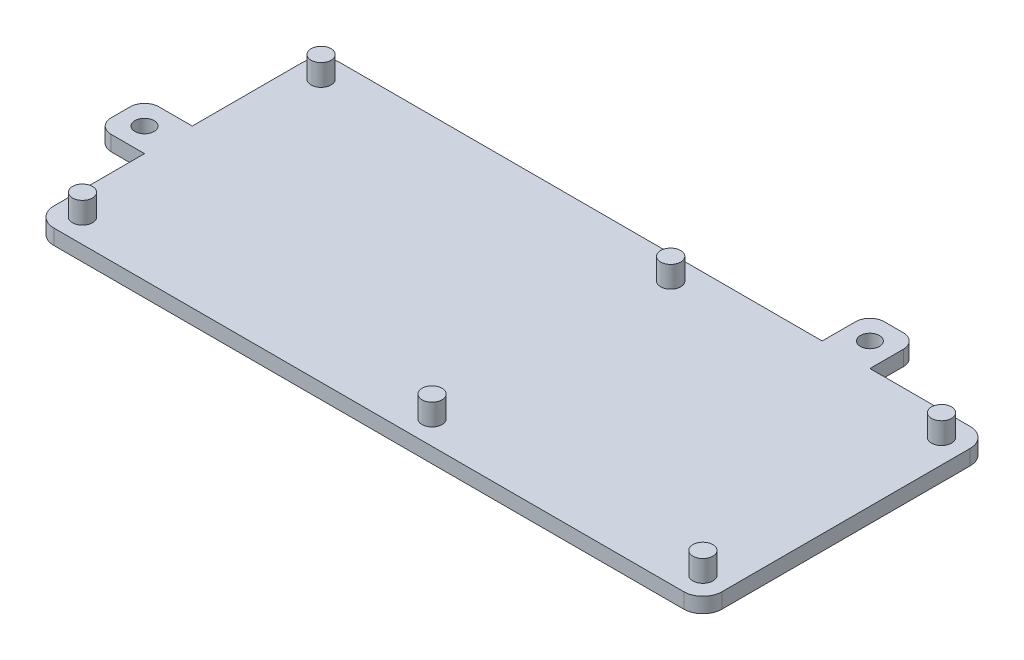
from build123d import *

# Parameters (mm, degrees)
SKETCH1_R             = 2.0955
BOSS_EXTRUDE1_DEPTH   = 4.5
BOSS_EXTRUDE1_2_DEPTH = 4.5
BOSS_EXTRUDE1_3_DEPTH = 4.5
BOSS_EXTRUDE1_4_DEPTH = 4.5
BOSS_EXTRUDE1_5_DEPTH = 4.5
BOSS_EXTRUDE1_6_DEPTH = 4.5
SKETCH2_W             = 140
SKETCH2_H             = 60
BOSS_EXTRUDE2_DEPTH   = 3.175
FILLET1_R             = 4
SKETCH3_W             = 10
SKETCH3_H             = 10
SKETCH3_R             = 2
BOSS_EXTRUDE3_DEPTH   = 3.175
FILLET3_R             = 3
FILLET4_R             = 3


with BuildPart() as part:
    # Sketch1 → Boss-Extrude1 (new body)
    with BuildSketch(Plane.XZ.offset(38.063324544)):
        with Locations((-181.839905385, -5.726884341)):
            Circle(SKETCH1_R)
    extrude(amount=BOSS_EXTRUDE1_DEPTH)



with BuildPart() as body_2:
    # Sketch1 → Boss-Extrude1 2 (new body)
    with BuildSketch(Plane.XZ.offset(38.063324544)):
        with Locations((-108.589905385, -5.726884341)):
            Circle(SKETCH1_R)
    extrude(amount=BOSS_EXTRUDE1_2_DEPTH)


with BuildPart() as body_3:
    # Sketch1 → Boss-Extrude1 3 (new body)
    with BuildSketch(Plane.XZ.offset(38.063324544)):
        with Locations((-51.839905385, -5.726884341)):
            Circle(SKETCH1_R)
    extrude(amount=BOSS_EXTRUDE1_3_DEPTH)


with BuildPart() as body_4:
    # Sketch1 → Boss-Extrude1 4 (new body)
    with BuildSketch(Plane.XZ.offset(38.063324544)):
        with Locations((-51.839905385, 44.273115659)):
            Circle(SKETCH1_R)
    extrude(amount=BOSS_EXTRUDE1_4_DEPTH)


with BuildPart() as body_5:
    # Sketch1 → Boss-Extrude1 5 (new body)
    with BuildSketch(Plane.XZ.offset(38.063324544)):
        with Locations((-108.589905385, 44.273115659)):
            Circle(SKETCH1_R)
    extrude(amount=BOSS_EXTRUDE1_5_DEPTH)


with BuildPart() as body_6:
    # Sketch1 → Boss-Extrude1 6 (new body)
    with BuildSketch(Plane.XZ.offset(38.063324544)):
        with Locations((-181.839905385, 44.273115659)):
            Circle(SKETCH1_R)
    extrude(amount=BOSS_EXTRUDE1_6_DEPTH)


with BuildPart() as part_1:
    add(part.part)

    add(body_2.part)  # Boss-Extrude2 merges body 2

    add(body_3.part)  # Boss-Extrude2 merges body 3

    add(body_4.part)  # Boss-Extrude2 merges body 4

    add(body_5.part)  # Boss-Extrude2 merges body 5

    add(body_6.part)  # Boss-Extrude2 merges body 6
    # Sketch2 → Boss-Extrude2 (add)
    with BuildSketch(Plane.XZ.offset(42.563324544)):
        with Locations((-116.839905385, 19.273115659)):
            Rectangle(SKETCH2_W, SKETCH2_H)
    extrude(amount=BOSS_EXTRUDE2_DEPTH)

    # Fillet1
    fillet1_edges = [part_1.edges().sort_by_distance(p)[0] for p in [
        (-46.839905385, -44.150824544, -10.726884341),
        (-46.839905385, -44.150824544, 49.273115659),
        (-186.839905385, -44.150824544, -10.726884341),
        (-186.839905385, -44.150824544, 49.273115659),
    ]]
    fillet(fillet1_edges, radius=FILLET1_R)

    # Sketch3 → Boss-Extrude3 (add)
    # profile 1 of 2: a face of its own
    with BuildSketch(Plane.XZ.offset(45.738324544)):
        with Locations((-191.839905385, 21.273115659)):
            Rectangle(SKETCH3_W, SKETCH3_H)
        with Locations((-191.839905385, 21.273115659)):
            Circle(SKETCH3_R, mode=Mode.SUBTRACT)
    # profile 2 of 2: a face of its own
    with BuildSketch(Plane.XZ.offset(45.738324544)):
        with Locations((-76.839905385, -15.726884341)):
            Rectangle(SKETCH3_W, SKETCH3_H)
        with Locations((-76.839905385, -15.726884341)):
            Circle(SKETCH3_R, mode=Mode.SUBTRACT)
    extrude(amount=-BOSS_EXTRUDE3_DEPTH)

    # Fillet3
    fillet3_edges = [part_1.edges().sort_by_distance(p)[0] for p in [
        (-81.839905385, -44.150824544, -20.726884341),
        (-71.839905385, -44.150824544, -20.726884341),
    ]]
    fillet(fillet3_edges, radius=FILLET3_R)

    # Fillet4
    fillet4_edges = [part_1.edges().sort_by_distance(p)[0] for p in [
        (-196.839905385, -44.150824544, 26.273115659),
        (-196.839905385, -44.150824544, 16.273115659),
    ]]
    fillet(fillet4_edges, radius=FILLET4_R)


solid = part_1.part
